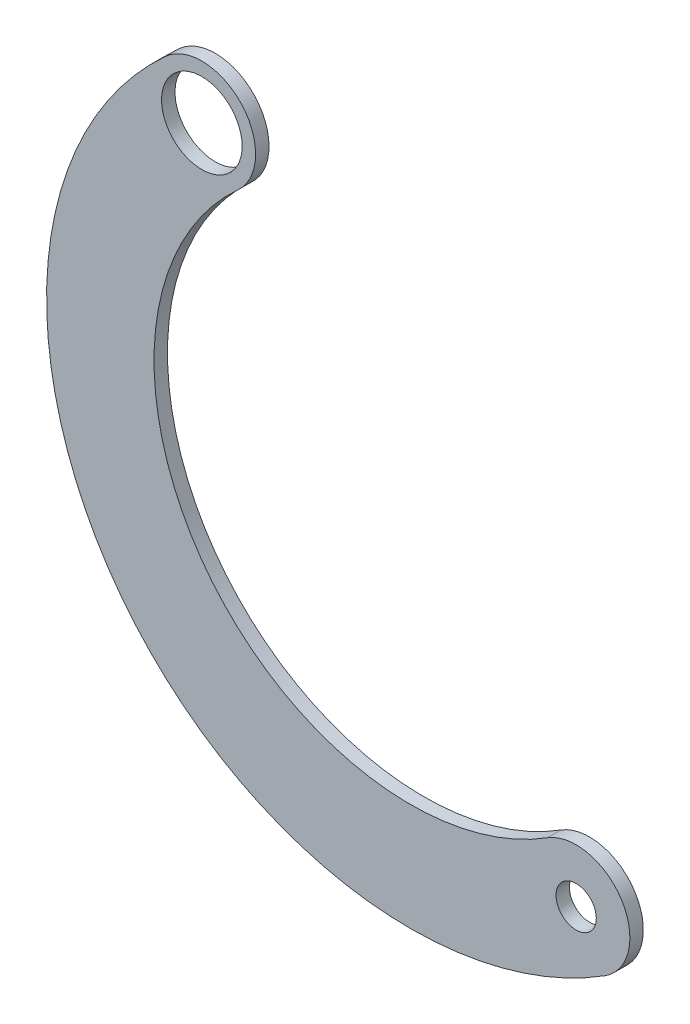
from build123d import *

# Parameters (mm, degrees)
ESQUISSE1_R               = 1.5
ESQUISSE1_R_2             = 3
T_LE_DE_BASE_PLI_E1_DEPTH = 1


# Sheet-metal steps are written as plain solids
with BuildPart() as part:
    # Esquisse1 → Tôle de base pliée1 (new body)
    with BuildSketch(Plane.XY):
        with BuildLine():
            ThreePointArc((-9.834171673, 7.957569633), (-13.169921185, -28.499832093), (22.861447454, -34.981331874))
            ThreePointArc((22.861447454, -34.981331874), (24.103395688, -29.462494624), (18.584558439, -28.22054639))
            ThreePointArc((18.584558439, -28.22054639), (-6.805057533, -23.653337412), (-4.454511265, 2.0364841))
            ThreePointArc((-4.454511265, 2.0364841), (-4.183798702, 7.686857071), (-9.834171673, 7.957569633))
        make_face()
        with Locations((20.723002946, -31.600939132)):
            Circle(ESQUISSE1_R, mode=Mode.SUBTRACT)
        with Locations((-7.144341469, 4.997026867)):
            Circle(ESQUISSE1_R_2, mode=Mode.SUBTRACT)
    extrude(amount=T_LE_DE_BASE_PLI_E1_DEPTH)


solid = part.part
